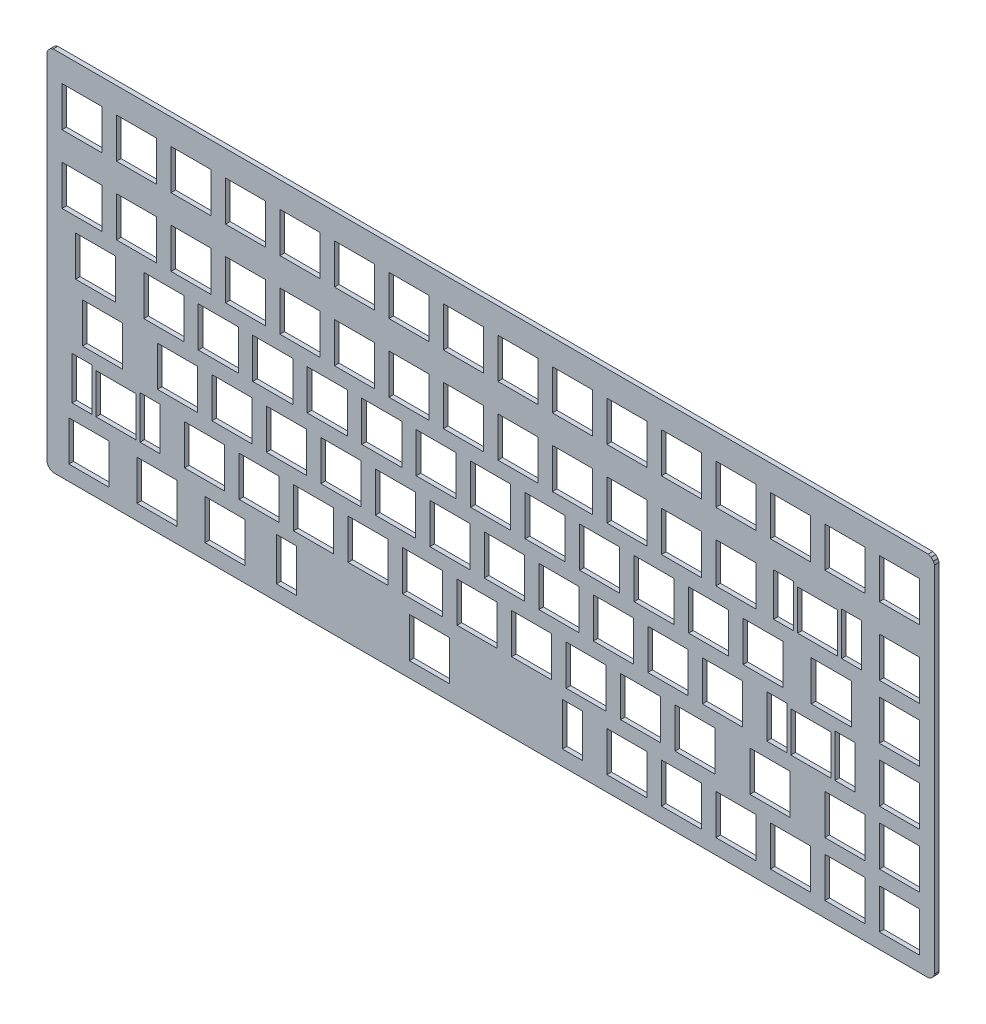
from build123d import *

# Parameters (mm, degrees)
BOSS_EXTRUDE1_DEPTH  = 1.6
SKETCH17_W           = 14
SKETCH17_H           = 14
CUT_EXTRUDE1_DEPTH   = 401.190052506
LPATTERN1_COUNT      = 16
LPATTERN1_PITCH      = 19.05
SKETCH18_W           = 14
SKETCH18_H           = 14
CUT_EXTRUDE2_DEPTH   = 401.190052506
LPATTERN2_COUNT      = 13
LPATTERN2_PITCH      = 19.05
LPATTERN3_COUNT      = 2
LPATTERN3_PITCH      = 257.175
SKETCH20_W           = 14
SKETCH20_H           = 14
CUT_EXTRUDE3_DEPTH   = 401.190052506
SKETCH22_W           = 14
SKETCH22_H           = 14
CUT_EXTRUDE4_DEPTH   = 401.190052506
LPATTERN4_COUNT      = 12
LPATTERN4_PITCH      = 19.05
SKETCH23_W           = 14
SKETCH23_H           = 14
CUT_EXTRUDE5_DEPTH   = 401.190052506
LPATTERN5_COUNT      = 11
LPATTERN5_PITCH      = 19.05
SKETCH24_W           = 14
SKETCH24_H           = 14
CUT_EXTRUDE6_DEPTH   = 401.190052506
LPATTERN6_COUNT      = 10
LPATTERN6_PITCH      = 19.05
SKETCH25_W           = 14
SKETCH25_H           = 14
CUT_EXTRUDE7_DEPTH   = 401.190052506
LPATTERN7_COUNT      = 3
LPATTERN7_PITCH      = 23.8125
SKETCH26_W           = 14
SKETCH26_H           = 14
CUT_EXTRUDE8_DEPTH   = 401.190052506
LPATTERN8_COUNT      = 2
LPATTERN8_PITCH      = 19.05
LPATTERN8_COUNT_DIR2 = 2
LPATTERN8_PITCH_DIR2 = 19.05
SKETCH27_W           = 14
SKETCH27_H           = 14
CUT_EXTRUDE9_DEPTH   = 401.190052506
LPATTERN9_COUNT      = 3
LPATTERN9_PITCH      = 19.05
SKETCH28_W           = 14
SKETCH28_H           = 14
CUT_EXTRUDE10_DEPTH  = 401.190052506
LPATTERN10_COUNT     = 4
LPATTERN10_PITCH     = 19.05
SKETCH29_W           = 14
SKETCH29_H           = 14
CUT_EXTRUDE11_DEPTH  = 401.190052506
LPATTERN11_COUNT     = 2
LPATTERN11_PITCH     = 257.175
SKETCH35_W           = 7
SKETCH35_H           = 15
CUT_EXTRUDE12_DEPTH  = 401.190052506
SKETCH37_W           = 14
SKETCH37_H           = 14
CUT_EXTRUDE13_DEPTH  = 401.190052506
SKETCH38_W           = 14
SKETCH38_H           = 14
CUT_EXTRUDE14_DEPTH  = 401.190052506
SKETCH39_W           = 7
SKETCH39_H           = 15
CUT_EXTRUDE15_DEPTH  = 401.190052506
SKETCH40_W           = 7
SKETCH40_H           = 15
SKETCH40_W_2         = 14
SKETCH40_H_2         = 14
CUT_EXTRUDE16_DEPTH  = 401.190052506
SKETCH41_W           = 14
SKETCH41_H           = 14
CUT_EXTRUDE17_DEPTH  = 401.190052506
SKETCH42_W           = 7
SKETCH42_H           = 15
CUT_EXTRUDE18_DEPTH  = 401.190052506


with BuildPart() as part:
    # Sketch14 → Boss-Extrude1 (new body)
    with BuildSketch(Plane.XY):
        Polygon((45.775, -56.546653), (45.778843, -56.507635), (45.790224, -56.470116), (46.170826, -55.551262), (46.189308, -55.516684), (46.214181, -55.486377), (46.961377, -54.73918), (46.991684, -54.714308), (47.026261, -54.695826), (47.945116, -54.315224), (47.982635, -54.303843), (48.021653, -54.3), (353.878347, -54.3), (353.917365, -54.303843), (353.954884, -54.315224), (354.873738, -54.695826), (354.908316, -54.714308), (354.938623, -54.739181), (355.68582, -55.486377), (355.710692, -55.516684), (355.729174, -55.551261), (356.109776, -56.470116), (356.121157, -56.507635), (356.125, -56.546653), (356.125, -180.303347), (356.121157, -180.342365), (356.109776, -180.379884), (355.729174, -181.298739), (355.710692, -181.333316), (355.68582, -181.363623), (354.938623, -182.110819), (354.908316, -182.135692), (354.873738, -182.154174), (353.954884, -182.534776), (353.917365, -182.546157), (353.878347, -182.55), (48.021653, -182.55), (47.982635, -182.546157), (47.945116, -182.534776), (47.026261, -182.154174), (46.991684, -182.135692), (46.961377, -182.11082), (46.214181, -181.363623), (46.189308, -181.333316), (46.170826, -181.298738), (45.790224, -180.379884), (45.778843, -180.342365), (45.775, -180.303347), align=None)
    extrude(amount=BOSS_EXTRUDE1_DEPTH)

    # Sketch17 → Cut-Extrude1 (cut, through all)
    with BuildSketch(Plane.XY.offset(1.6)):
        with Locations((58.072891709, -70.2375)):
            Rectangle(SKETCH17_W, SKETCH17_H)
    cut_extrude1 = extrude(amount=-CUT_EXTRUDE1_DEPTH, mode=Mode.SUBTRACT)

    # LPattern1: Cut-Extrude1 ×16
    with Locations(*[(i * LPATTERN1_PITCH, 0, 0) for i in range(1, LPATTERN1_COUNT)]):
        add(cut_extrude1, mode=Mode.SUBTRACT)

    # Sketch18 → Cut-Extrude2 (cut, through all)
    with BuildSketch(Plane.XY.offset(1.6)):
        with Locations((58.073441718, -94.051507519)):
            Rectangle(SKETCH18_W, SKETCH18_H)
    cut_extrude2 = extrude(amount=-CUT_EXTRUDE2_DEPTH, mode=Mode.SUBTRACT)

    # LPattern2: Cut-Extrude2 ×13
    with Locations(*[(i * LPATTERN2_PITCH, 0, 0) for i in range(1, LPATTERN2_COUNT)]):
        add(cut_extrude2, mode=Mode.SUBTRACT)

    # LPattern3: Cut-Extrude2 ×2
    with Locations(*[(i * LPATTERN3_PITCH, 0, 0) for i in range(1, LPATTERN3_COUNT)]):
        add(cut_extrude2, mode=Mode.SUBTRACT)

    # Sketch20 → Cut-Extrude3 (cut, through all)
    with BuildSketch(Plane.XY.offset(1.6)):
        with Locations((62.831674868, -113.106226091)):
            Rectangle(SKETCH20_W, SKETCH20_H)
    cut_extrude3 = extrude(amount=-CUT_EXTRUDE3_DEPTH, mode=Mode.SUBTRACT)

    # Sketch22 → Cut-Extrude4 (cut, through all)
    with BuildSketch(Plane.XY.offset(1.6)):
        with Locations((86.65, -113.1)):
            Rectangle(SKETCH22_W, SKETCH22_H)
    cut_extrude4 = extrude(amount=-CUT_EXTRUDE4_DEPTH, mode=Mode.SUBTRACT)

    # LPattern4: Cut-Extrude4 ×12
    with Locations(*[(i * LPATTERN4_PITCH, 0, 0) for i in range(1, LPATTERN4_COUNT)]):
        add(cut_extrude4, mode=Mode.SUBTRACT)

    # Sketch23 → Cut-Extrude5 (cut, through all)
    with BuildSketch(Plane.XY.offset(1.6)):
        with Locations((91.4125, -132.15)):
            Rectangle(SKETCH23_W, SKETCH23_H)
    cut_extrude5 = extrude(amount=-CUT_EXTRUDE5_DEPTH, mode=Mode.SUBTRACT)

    # LPattern5: Cut-Extrude5 ×11
    with Locations(*[(i * LPATTERN5_PITCH, 0, 0) for i in range(1, LPATTERN5_COUNT)]):
        add(cut_extrude5, mode=Mode.SUBTRACT)

    # Sketch24 → Cut-Extrude6 (cut, through all)
    with BuildSketch(Plane.XY.offset(1.6)):
        with Locations((100.9375, -151.2)):
            Rectangle(SKETCH24_W, SKETCH24_H)
    cut_extrude6 = extrude(amount=-CUT_EXTRUDE6_DEPTH, mode=Mode.SUBTRACT)

    # LPattern6: Cut-Extrude6 ×10
    with Locations(*[(i * LPATTERN6_PITCH, 0, 0) for i in range(1, LPATTERN6_COUNT)]):
        add(cut_extrude6, mode=Mode.SUBTRACT)

    # Sketch25 → Cut-Extrude7 (cut, through all)
    with BuildSketch(Plane.XY.offset(1.6)):
        with Locations((60.45625, -170.25)):
            Rectangle(SKETCH25_W, SKETCH25_H)
    cut_extrude7 = extrude(amount=-CUT_EXTRUDE7_DEPTH, mode=Mode.SUBTRACT)

    # LPattern7: Cut-Extrude7 ×3
    with Locations(*[(i * LPATTERN7_PITCH, 0, 0) for i in range(1, LPATTERN7_COUNT)]):
        add(cut_extrude7, mode=Mode.SUBTRACT)

    # Sketch26 → Cut-Extrude8 (cut, through all)
    with BuildSketch(Plane.XY.offset(1.6)):
        with Locations((324.775, -151.2)):
            Rectangle(SKETCH26_W, SKETCH26_H)
    cut_extrude8 = extrude(amount=-CUT_EXTRUDE8_DEPTH, mode=Mode.SUBTRACT)

    # LPattern8: Cut-Extrude8 2 × 2
    with Locations(*[(i * LPATTERN8_PITCH, -j * LPATTERN8_PITCH_DIR2, 0) for i in range(LPATTERN8_COUNT) for j in range(LPATTERN8_COUNT_DIR2) if (i, j) != (0, 0)]):
        add(cut_extrude8, mode=Mode.SUBTRACT)

    # Sketch27 → Cut-Extrude9 (cut, through all)
    with BuildSketch(Plane.XY.offset(1.6)):
        with Locations((343.825, -94.05)):
            Rectangle(SKETCH27_W, SKETCH27_H)
    cut_extrude9 = extrude(amount=-CUT_EXTRUDE9_DEPTH, mode=Mode.SUBTRACT)

    # LPattern9: Cut-Extrude9 ×3
    with Locations(*[(0, -i * LPATTERN9_PITCH, 0) for i in range(1, LPATTERN9_COUNT)]):
        add(cut_extrude9, mode=Mode.SUBTRACT)

    # Sketch28 → Cut-Extrude10 (cut, through all)
    with BuildSketch(Plane.XY.offset(1.6)):
        with Locations((248.575, -170.25)):
            Rectangle(SKETCH28_W, SKETCH28_H)
    cut_extrude10 = extrude(amount=-CUT_EXTRUDE10_DEPTH, mode=Mode.SUBTRACT)

    # LPattern10: Cut-Extrude10 ×4
    with Locations(*[(i * LPATTERN10_PITCH, 0, 0) for i in range(1, LPATTERN10_COUNT)]):
        add(cut_extrude10, mode=Mode.SUBTRACT)

    # Sketch29 → Cut-Extrude11 (cut, through all)
    with BuildSketch(Plane.XY.offset(1.6)):
        with Locations((179.51875, -170.25)):
            Rectangle(SKETCH29_W, SKETCH29_H)
    extrude(amount=-CUT_EXTRUDE11_DEPTH, mode=Mode.SUBTRACT)

    # LPattern11: Cut-Extrude3 ×2
    with Locations(*[(i * LPATTERN11_PITCH, 0, 0) for i in range(1, LPATTERN11_COUNT)]):
        add(cut_extrude3, mode=Mode.SUBTRACT)

    # Sketch35 → Cut-Extrude12 (cut, through all)
    with BuildSketch(Plane.XY.offset(1.6)):
        with Locations((129.51875, -169.75)):
            Rectangle(SKETCH35_W, SKETCH35_H)
        with Locations((229.51875, -169.75)):
            Rectangle(SKETCH35_W, SKETCH35_H)
    extrude(amount=-CUT_EXTRUDE12_DEPTH, mode=Mode.SUBTRACT)

    # Sketch37 → Cut-Extrude13 (cut, through all)
    with BuildSketch(Plane.XY.offset(1.6)):
        with Locations((65.21875, -132.15)):
            Rectangle(SKETCH37_W, SKETCH37_H)
    extrude(amount=-CUT_EXTRUDE13_DEPTH, mode=Mode.SUBTRACT)

    # Sketch38 → Cut-Extrude14 (cut, through all)
    with BuildSketch(Plane.XY.offset(1.6)):
        with Locations((69.98125, -151.2)):
            Rectangle(SKETCH38_W, SKETCH38_H)
    extrude(amount=-CUT_EXTRUDE14_DEPTH, mode=Mode.SUBTRACT)

    # Sketch39 → Cut-Extrude15 (cut, through all)
    with BuildSketch(Plane.XY.offset(1.6)):
        with Locations((81.88125, -150.6894482)):
            Rectangle(SKETCH39_W, SKETCH39_H)
        with Locations((58.08125, -150.6894482)):
            Rectangle(SKETCH39_W, SKETCH39_H)
    extrude(amount=-CUT_EXTRUDE15_DEPTH, mode=Mode.SUBTRACT)

    # Sketch40 → Cut-Extrude16 (cut, through all)
    with BuildSketch(Plane.XY.offset(1.6)):
        with Locations((324.76875, -131.65)):
            Rectangle(SKETCH40_W, SKETCH40_H)
        with Locations((312.86875, -132.15)):
            Rectangle(SKETCH40_W_2, SKETCH40_H_2)
        with Locations((300.96875, -131.65)):
            Rectangle(SKETCH40_W, SKETCH40_H)
    extrude(amount=-CUT_EXTRUDE16_DEPTH, mode=Mode.SUBTRACT)

    # Sketch41 → Cut-Extrude17 (cut, through all)
    with BuildSketch(Plane.XY.offset(1.6)):
        with Locations((298.58125, -151.2)):
            Rectangle(SKETCH41_W, SKETCH41_H)
    extrude(amount=-CUT_EXTRUDE17_DEPTH, mode=Mode.SUBTRACT)

    # Sketch42 → Cut-Extrude18 (cut, through all)
    with BuildSketch(Plane.XY.offset(1.6)):
        with Locations((303.326378039, -93.551507519)):
            Rectangle(SKETCH42_W, SKETCH42_H)
        with Locations((327.126378039, -93.551507519)):
            Rectangle(SKETCH42_W, SKETCH42_H)
    extrude(amount=-CUT_EXTRUDE18_DEPTH, mode=Mode.SUBTRACT)


solid = part.part
